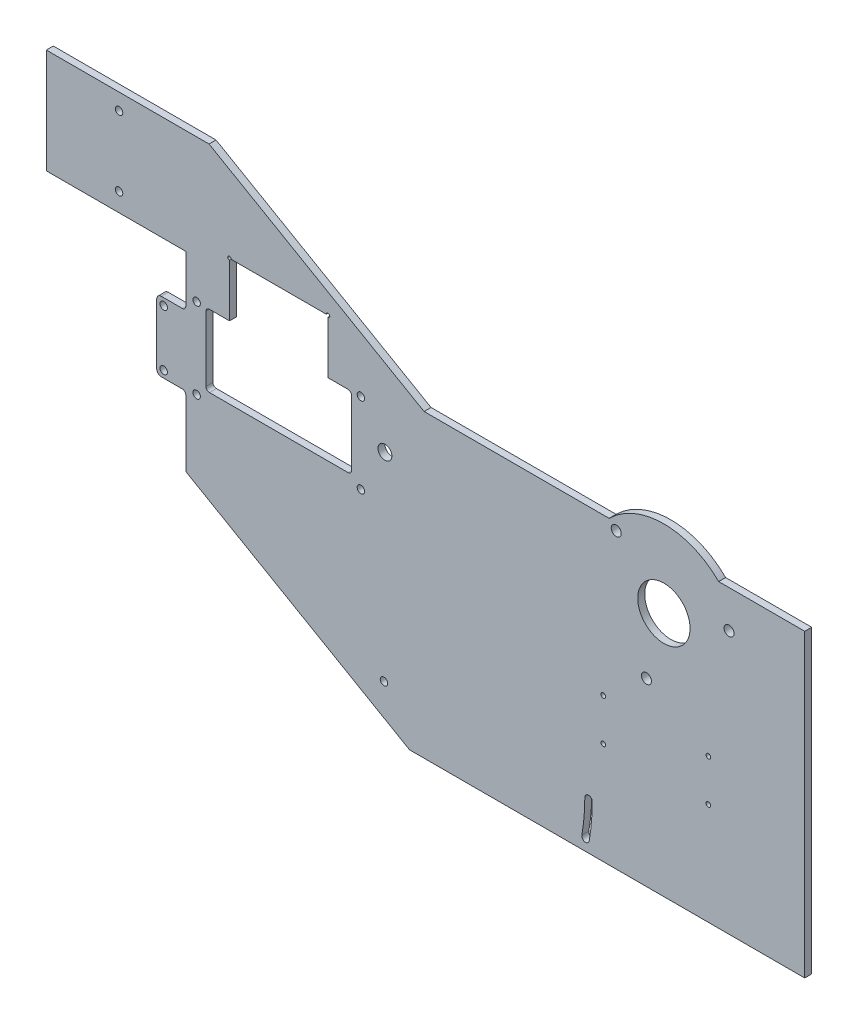
from build123d import *

# Parameters (mm, degrees)
SKETCH1_W           = 184.414327478
SKETCH1_H           = 83.61431582
BOSS_EXTRUDE1_DEPTH = 3
SKETCH2_R           = 3
CUT_EXTRUDE1_DEPTH  = 70
SKETCH3_R           = 11.25
CUT_EXTRUDE2_DEPTH  = 3
SKETCH4_R           = 1.6
BOSS_EXTRUDE2_DEPTH = 3
CUT_EXTRUDE3_DEPTH  = 10
SKETCH6_R           = 1.6
CUT_EXTRUDE4_DEPTH  = 3
FILLET1_R           = 1.5
SKETCH8_R           = 1.6
CUT_EXTRUDE6_DEPTH  = 12
SKETCH9_R           = 2.15
CUT_EXTRUDE7_DEPTH  = 12
BOSS_EXTRUDE3_DEPTH = 3
SKETCH12_R          = 1.6
CUT_EXTRUDE8_DEPTH  = 10
SKETCH13_R          = 1
CUT_EXTRUDE9_DEPTH  = 10


with BuildPart() as part:
    # Sketch1 → Boss-Extrude1 (new body)
    with BuildSketch(Plane.XY):
        with Locations((112.494062572, 5.79284209)):
            Rectangle(SKETCH1_W, SKETCH1_H)
    extrude(amount=BOSS_EXTRUDE1_DEPTH)

    # Sketch2 → Cut-Extrude1 (cut)
    with BuildSketch(Plane(origin=(0, 0, 0), x_dir=(-1, 0, 0), z_dir=(0, 0, -1))):
        with Locations((-24.116880081, 24)):
            Circle(SKETCH2_R)
    extrude(amount=-CUT_EXTRUDE1_DEPTH, mode=Mode.SUBTRACT)

    # Sketch3 → Cut-Extrude2 (cut)
    with BuildSketch(Plane.XY.offset(3)):
        with Locations((144.116880081, 24)):
            Circle(SKETCH3_R)
    extrude(amount=-CUT_EXTRUDE2_DEPTH, mode=Mode.SUBTRACT)

    # Sketch4 → Boss-Extrude2 (add)
    with BuildSketch(Plane.XY.offset(3)):
        with BuildLine():
            Line((-61.543119919, 56), (-61.543119919, 34))
            Line((-61.543119919, 34), (-72.043119919, 34))
            ThreePointArc((-72.043119919, 34), (-73.457333481, 33.414213562), (-74.043119919, 32))
            Line((-74.043119919, 32), (-74.043119919, 6))
            ThreePointArc((-74.043119919, 6), (-73.457333481, 4.585786438), (-72.043119919, 4))
            Line((-72.043119919, 4), (-61.543119919, 4))
            Line((-61.543119919, 4), (-61.543119919, -26))
            Line((-61.543119919, -26), (34.701226311, -81.566699204))
            Line((34.701226311, -81.566699204), (204.701226311, -81.566699204))
            Line((204.701226311, -81.566699204), (204.701226311, -36.01431582))
            Line((204.701226311, -36.01431582), (20.286898833, -36.01431582))
            Line((20.286898833, -36.01431582), (20.286898833, 47.6))
            Line((20.286898833, 47.6), (40.948393205, 47.6))
            Line((40.948393205, 47.6), (-51.543119919, 101))
            Line((-51.543119919, 101), (-121.543119919, 101))
            Line((-121.543119919, 101), (-121.543119919, 56))
            Line((-121.543119919, 56), (-61.543119919, 56))
        make_face()
        with Locations((-71.043119919, 31)):
            Circle(SKETCH4_R, mode=Mode.SUBTRACT)
        with Locations((-71.043119919, 7)):
            Circle(SKETCH4_R, mode=Mode.SUBTRACT)
    extrude(amount=-BOSS_EXTRUDE2_DEPTH)

    # Sketch5 → Cut-Extrude3 (cut)
    with BuildSketch(Plane.XY.offset(3)):
        with BuildLine():
            Line((-51.373138671, 8.5), (8.286898833, 8.5))
            ThreePointArc((8.286898833, 8.5), (9.347559005, 8.939339828), (9.786898833, 10))
            Line((9.786898833, 10), (9.786898833, 38))
            ThreePointArc((9.786898833, 38), (9.347559005, 39.060660172), (8.286898833, 39.5))
            Line((8.286898833, 39.5), (-0.343119919, 39.5))
            Line((-0.343119919, 39.5), (-0.343119919, 62.05))
            ThreePointArc((-0.343119919, 62.05), (0.187210167, 63.330330086), (-1.093119919, 62.8))
            Line((-1.093119919, 62.8), (-41.993119919, 62.8))
            ThreePointArc((-41.993119919, 62.8), (-43.273450005, 63.330330086), (-42.743119919, 62.05))
            Line((-42.743119919, 62.05), (-42.743119919, 39.5))
            Line((-42.743119919, 39.5), (-51.373138671, 39.5))
            ThreePointArc((-51.373138671, 39.5), (-52.433798843, 39.060660172), (-52.873138671, 38))
            Line((-52.873138671, 38), (-52.873138671, 10))
            ThreePointArc((-52.873138671, 10), (-52.433798843, 8.939339828), (-51.373138671, 8.5))
        make_face()
    extrude(amount=-CUT_EXTRUDE3_DEPTH, mode=Mode.SUBTRACT)

    # Sketch6 → Cut-Extrude4 (cut)
    with BuildSketch(Plane.XY.offset(3)):
        with Locations((13.786898833, 5)):
            Circle(SKETCH6_R)
        with Locations((13.786898833, 39.6)):
            Circle(SKETCH6_R)
        with Locations((-56.873138671, 5)):
            Circle(SKETCH6_R)
        with Locations((-56.873138671, 39.6)):
            Circle(SKETCH6_R)
    extrude(amount=-CUT_EXTRUDE4_DEPTH, mode=Mode.SUBTRACT)

    # Fillet1
    fillet1_edges = [part.edges().sort_by_distance(p)[0] for p in [
        (-61.543119919, 4, 1.5),
        (-61.543119919, 34, 1.5),
    ]]
    fillet(fillet1_edges, radius=FILLET1_R)

    # Sketch8 → Cut-Extrude6 (cut)
    with BuildSketch(Plane.XY.offset(3)):
        with Locations((-90.243119919, 94)):
            Circle(SKETCH8_R)
        with Locations((-90.243119919, 64)):
            Circle(SKETCH8_R)
    extrude(amount=-CUT_EXTRUDE6_DEPTH, mode=Mode.SUBTRACT)

    # Sketch9 → Cut-Extrude7 (cut)
    with BuildSketch(Plane(origin=(0, 0, 0), x_dir=(-1, 0, 0), z_dir=(0, 0, -1))):
        with Locations((-172.128729044, 31.505752308)):
            Circle(SKETCH9_R)
        with Locations((-123.610783427, 44.506096654)):
            Circle(SKETCH9_R)
        with Locations((-136.611127773, -4.011848962)):
            Circle(SKETCH9_R)
    extrude(amount=-CUT_EXTRUDE7_DEPTH, mode=Mode.SUBTRACT)

    # Sketch10 → Boss-Extrude3 (add)
    with BuildSketch(Plane(origin=(0, 0, 0), x_dir=(-1, 0, 0), z_dir=(0, 0, -1))):
        with BuildLine():
            Line((-167.680888654, 47.6), (-120.552871509, 47.6))
            ThreePointArc((-120.552871509, 47.6), (-144.116880081, 57.35), (-167.680888654, 47.6))
        make_face()
    extrude(amount=-BOSS_EXTRUDE3_DEPTH)

    # Sketch12 → Cut-Extrude8 (cut)
    with BuildSketch(Plane.XY.offset(3)):
        with Locations((23.701226311, -61.566699204)):
            Circle(SKETCH12_R)
        with BuildLine():
            ThreePointArc((110.101226311, -61.566699204), (109.784541603, -68.957425033), (108.836808989, -76.293971931))
            ThreePointArc((108.836808989, -76.293971931), (110.140666581, -78.143284068), (111.989978718, -76.839426476))
            ThreePointArc((111.989978718, -76.839426476), (112.97281254, -69.231155619), (113.301226311, -61.566699204))
            ThreePointArc((113.301226311, -61.566699204), (111.701226311, -59.966699204), (110.101226311, -61.566699204))
        make_face()
    extrude(amount=-CUT_EXTRUDE8_DEPTH, mode=Mode.SUBTRACT)

    # Sketch13 → Cut-Extrude9 (cut)
    with BuildSketch(Plane(origin=(0, 0, 0), x_dir=(-1, 0, 0), z_dir=(0, 0, -1))):
        with Locations((-163.256880081, -19.666699204)):
            Circle(SKETCH13_R)
        with Locations((-163.256880081, -37.666699204)):
            Circle(SKETCH13_R)
        with Locations((-118.056880081, -19.666699204)):
            Circle(SKETCH13_R)
        with Locations((-118.056880081, -37.666699204)):
            Circle(SKETCH13_R)
    extrude(amount=-CUT_EXTRUDE9_DEPTH, mode=Mode.SUBTRACT)


solid = part.part
